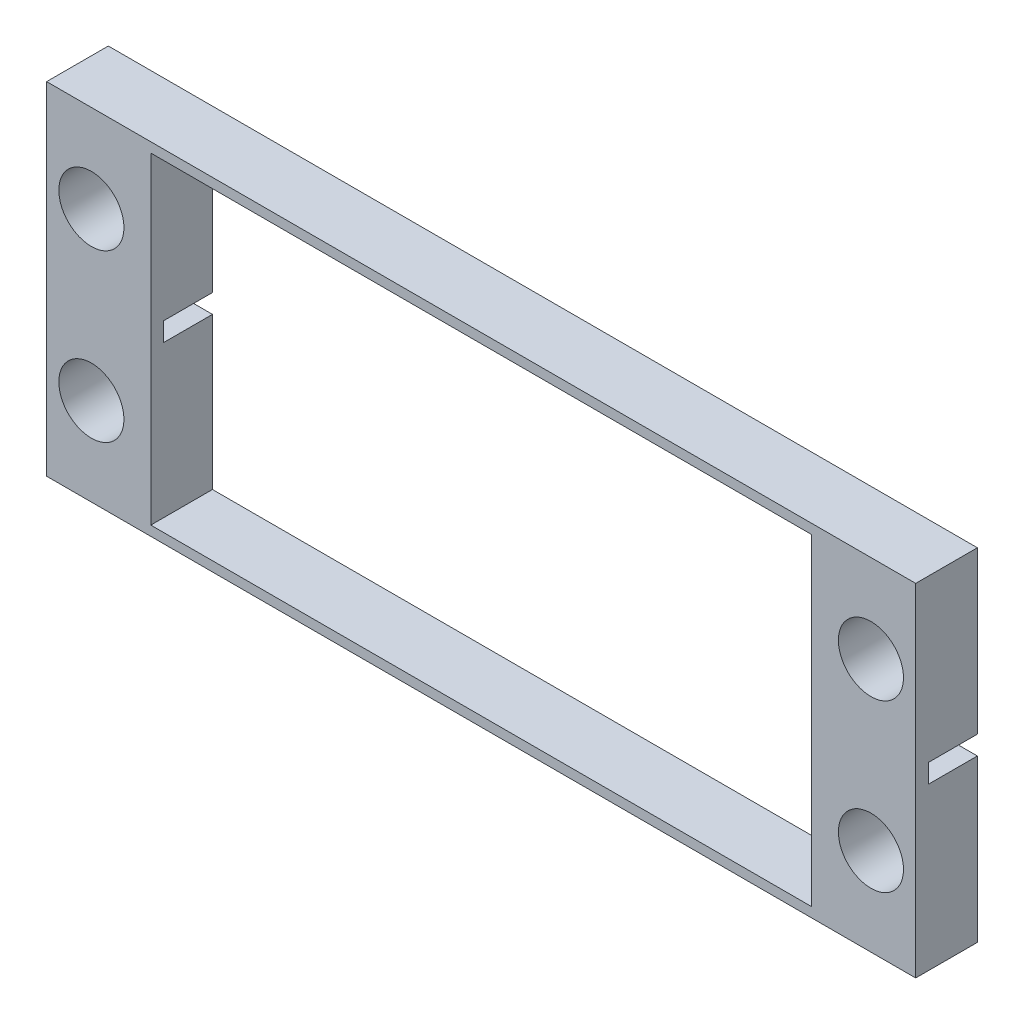
from build123d import *

# Parameters (mm, degrees)
SKETCH1_W           = 53.4
SKETCH1_H           = 21
BOSS_EXTRUDE2_DEPTH = 3.79000004
SKETCH3_W           = 40.6
SKETCH3_H           = 19.8
CUT_EXTRUDE1_DEPTH  = 29.939663099
SKETCH4_W           = 3
SKETCH4_H           = 1.16
CUT_EXTRUDE2_DEPTH  = 55.554322471
SKETCH5_R           = 2
CUT_EXTRUDE3_DEPTH  = 6.33


with BuildPart() as part:
    # Sketch1 → Boss-Extrude2 (new body)
    with BuildSketch(Plane.XY):
        Rectangle(SKETCH1_W, SKETCH1_H)
    extrude(amount=BOSS_EXTRUDE2_DEPTH)

    # Sketch3 → Cut-Extrude1 (cut, through all)
    with BuildSketch(Plane.XY.offset(3.79000004)):
        Rectangle(SKETCH3_W, SKETCH3_H)
    extrude(amount=-CUT_EXTRUDE1_DEPTH, mode=Mode.SUBTRACT)

    # Sketch4 → Cut-Extrude2 (cut, through all)
    with BuildSketch(Plane.ZY.offset(26.7)):
        with Locations((1.5, 0)):
            Rectangle(SKETCH4_W, SKETCH4_H)
    extrude(amount=-CUT_EXTRUDE2_DEPTH, mode=Mode.SUBTRACT)

    # Sketch5 → Cut-Extrude3 (cut)
    with BuildSketch(Plane.XY.offset(3.79000004)):
        with Locations((-23.95, 5.1)):
            Circle(SKETCH5_R)
        with Locations((-23.95, -5.1)):
            Circle(SKETCH5_R)
        with Locations((23.95, -5.1)):
            Circle(SKETCH5_R)
        with Locations((23.95, 5.1)):
            Circle(SKETCH5_R)
    extrude(amount=-CUT_EXTRUDE3_DEPTH, mode=Mode.SUBTRACT)


solid = part.part
